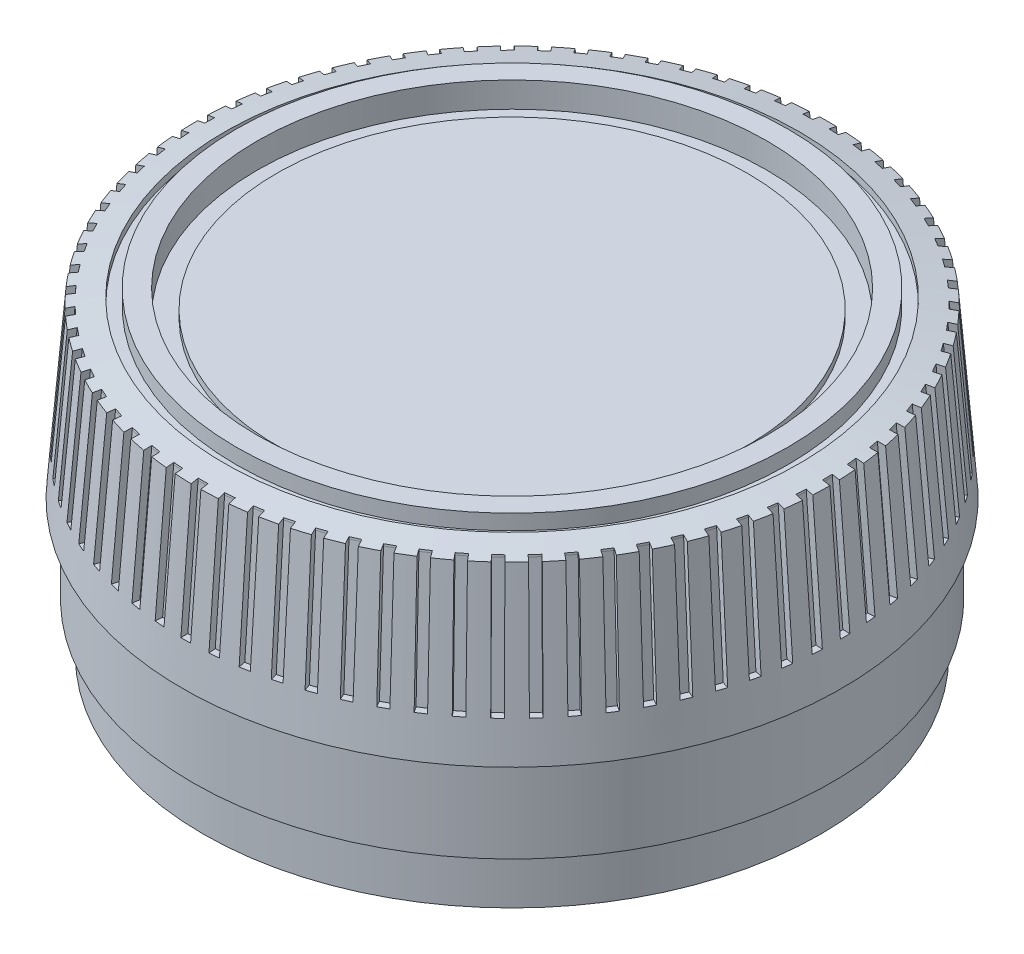
from build123d import *

# Parameters (mm, degrees)
CUT_EXTRUDE1_DEPTH  = 0.35
CIRPATTERN1_COUNT   = 75
BOSS_EXTRUDE1_START = 13.25
BOSS_EXTRUDE1_DEPTH = 13.25
SKETCH4_R           = 5
BOSS_EXTRUDE2_DEPTH = 20.1
CUT_EXTRUDE2_DEPTH  = 20.1


with BuildPart() as part:
    # Sketch1 → Revolve1 (revolve)
    with BuildSketch(Plane(origin=(0, 0, 0), x_dir=(0, 0, -1), z_dir=(1, 0, 0))):
        Polygon((-22.3, 0), (-22.3, 3.6), (-23.065, 3.6), (-23.065, 9.86), (-23.8, 9.86), (-22.825, 22), (-20.75, 22.4), (-20.75, 21.9), (-19.91, 21.9), (-19.91, 23), (-18.41, 23), (-18.41, 21.17), (-17.01, 21.17), (-17.01, 21.67), (0, 21.67), (0, 19.92), (-14.75, 19.92), (-14.75, 18.69), (-20.855, 18.69), (-20.855, 0), align=None)
    revolve(axis=Axis((0, 0, 0), (0, 1, 0)))

    # Sketch2 → Cut-Extrude1 (cut, symmetric)
    with BuildSketch(Plane(origin=(0, 0, 0), x_dir=(0, 0, -1), z_dir=(1, 0, 0))):
        Polygon((-22.825, 22), (-23.567895387, 12.75), (-23.066285434, 12.75), (-22.326604786, 21.959972378), (-22.274753574, 22.466211296), (-22.654676851, 22.466211296), align=None)
    cut_extrude1 = extrude(amount=CUT_EXTRUDE1_DEPTH, both=True, mode=Mode.SUBTRACT)

    # CirPattern1: Cut-Extrude1 ×75 about axis
    cirpattern1_axis = Axis((0, 23, 0), (0, -1, 0))
    for i in range(1, CIRPATTERN1_COUNT):
        add(cut_extrude1.rotate(cirpattern1_axis, i * 360 / CIRPATTERN1_COUNT), mode=Mode.SUBTRACT)

    # Sketch3 → Boss-Extrude1 (add)
    with BuildSketch(Plane.XZ.offset(-19.92).offset(BOSS_EXTRUDE1_START)):
        with BuildLine():
            Line((-0.65, -0.65), (-0.65, -20.844868073))
            ThreePointArc((-0.65, -20.844868073), (0, -20.855), (0.65, -20.844868073))
            Line((0.65, -20.844868073), (0.65, -0.65))
            Line((0.65, -0.65), (20.844868073, -0.65))
            ThreePointArc((20.844868073, -0.65), (20.855, 0), (20.844868073, 0.65))
            Line((20.844868073, 0.65), (0.65, 0.65))
            Line((0.65, 0.65), (0.65, 20.844868073))
            ThreePointArc((0.65, 20.844868073), (0, 20.855), (-0.65, 20.844868073))
            Line((-0.65, 20.844868073), (-0.65, 0.65))
            Line((-0.65, 0.65), (-20.844868073, 0.65))
            ThreePointArc((-20.844868073, 0.65), (-20.855, 0), (-20.844868073, -0.65))
            Line((-20.844868073, -0.65), (-0.65, -0.65))
        make_face()
    extrude(amount=-BOSS_EXTRUDE1_DEPTH)

    # Sketch4 → Boss-Extrude2 (add)
    with BuildSketch(Plane.XZ.offset(-19.92)):
        Circle(SKETCH4_R)
    extrude(amount=BOSS_EXTRUDE2_DEPTH)

    # Sketch5 → Cut-Extrude2 (cut)
    with BuildSketch(Plane.XZ.offset(0.18)):
        with BuildLine():
            Line((1.549742044, 2.822534251), (-2.822534251, -1.549742044))
            ThreePointArc((-2.822534251, -1.549742044), (2.276883835, -2.276883835), (1.549742044, 2.822534251))
        make_face()
    extrude(amount=-CUT_EXTRUDE2_DEPTH, mode=Mode.SUBTRACT)


solid = part.part
